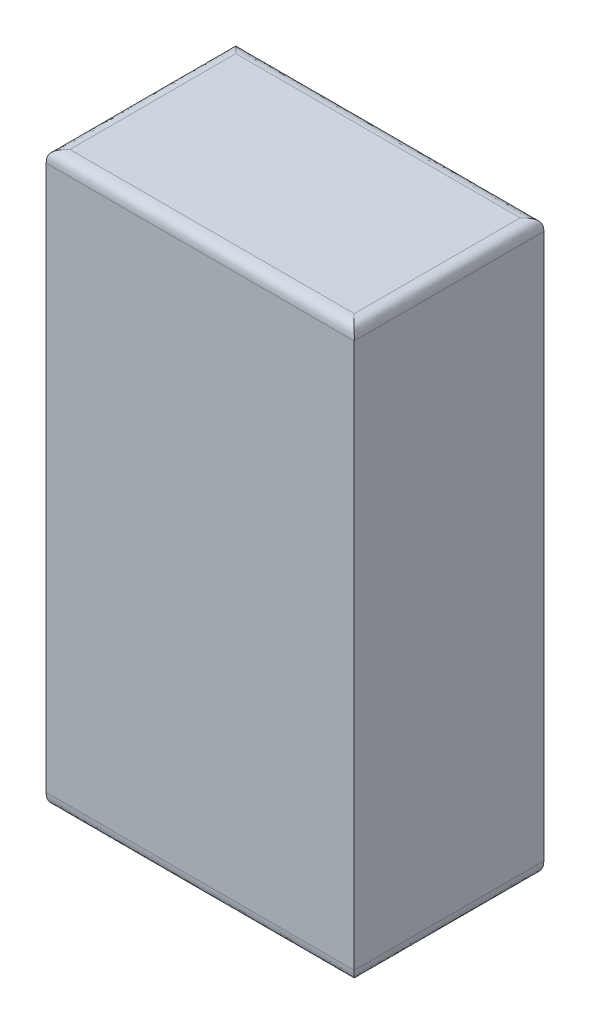
from build123d import *

# Parameters (mm, degrees)
SKETCH1_W           = 26
SKETCH1_H           = 48
BOSS_EXTRUDE1_DEPTH = 16
FILLET1_SIZE        = 1


with BuildPart() as part:
    # Sketch1 → Boss-Extrude1 (new body)
    with BuildSketch(Plane.XY):
        with Locations((-11.532370597, -6.18815331)):
            Rectangle(SKETCH1_W, SKETCH1_H)
    extrude(amount=BOSS_EXTRUDE1_DEPTH)

    # Fillet1
    # a fillet whose section is not a circle: 1 mm, written as the material it takes off along each edge
    with BuildSketch(Plane(origin=(-24.532370597, -30.18815331, -2.5), x_dir=(1, 0, 0), z_dir=(0, 0, 1)), Plane(origin=(1.467629403, -30.18815331, -2.5), x_dir=(0, 1, 0), z_dir=(0, 0, 1)), Plane(origin=(1.467629403, 17.81184669, -2.5), x_dir=(-1, 0, 0), z_dir=(0, 0, 1))) as fillet1_piece_1:
        with BuildLine():
            add(Edge.make_bspline([(FILLET1_SIZE, 0), (FILLET1_SIZE * 0.831801948466, 0), (FILLET1_SIZE * 0.663603896932, 0), (FILLET1_SIZE * 0.292893218813, FILLET1_SIZE * 0.0716919198361), (FILLET1_SIZE * 0.0716919198361, FILLET1_SIZE * 0.292893218813), (0, FILLET1_SIZE * 0.663603896932), (0, FILLET1_SIZE * 0.831801948466), (0, FILLET1_SIZE)], knots=[0, 0, 0, 0, 0, 0, 0.5, 0.5, 1, 1, 1, 1, 1, 1], degree=5))
            Line((0, FILLET1_SIZE), (0, 0))
            Line((0, 0), (FILLET1_SIZE, 0))
        make_face()
    extrude(amount=21, mode=Mode.SUBTRACT)
    with BuildSketch(Plane(origin=(3.967629403, -30.18815331, 0), x_dir=(0, 0, 1), z_dir=(-1, 0, 0)), Plane(origin=(-27.032370597, 17.81184669, 0), x_dir=(0, 0, 1), z_dir=(1, 0, 0))) as fillet1_piece_2:
        with BuildLine():
            add(Edge.make_bspline([(FILLET1_SIZE, 0), (FILLET1_SIZE * 0.831801948466, 0), (FILLET1_SIZE * 0.663603896932, 0), (FILLET1_SIZE * 0.292893218813, FILLET1_SIZE * 0.0716919198361), (FILLET1_SIZE * 0.0716919198361, FILLET1_SIZE * 0.292893218813), (0, FILLET1_SIZE * 0.663603896932), (0, FILLET1_SIZE * 0.831801948466), (0, FILLET1_SIZE)], knots=[0, 0, 0, 0, 0, 0, 0.5, 0.5, 1, 1, 1, 1, 1, 1], degree=5))
            Line((0, FILLET1_SIZE), (0, 0))
            Line((0, 0), (FILLET1_SIZE, 0))
        make_face()
    extrude(amount=31, mode=Mode.SUBTRACT)
    with BuildSketch(Plane(origin=(3.967629403, -30.18815331, 16), x_dir=(0, 0, -1), z_dir=(-1, 0, 0)), Plane(origin=(-27.032370597, 17.81184669, 16), x_dir=(0, 0, -1), z_dir=(1, 0, 0))) as fillet1_piece_3:
        with BuildLine():
            add(Edge.make_bspline([(FILLET1_SIZE, 0), (FILLET1_SIZE * 0.831801948466, 0), (FILLET1_SIZE * 0.663603896932, 0), (FILLET1_SIZE * 0.292893218813, -FILLET1_SIZE * 0.0716919198361), (FILLET1_SIZE * 0.0716919198361, -FILLET1_SIZE * 0.292893218813), (0, -FILLET1_SIZE * 0.663603896932), (0, -FILLET1_SIZE * 0.831801948466), (0, -FILLET1_SIZE)], knots=[0, 0, 0, 0, 0, 0, 0.5, 0.5, 1, 1, 1, 1, 1, 1], degree=5))
            Line((0, -FILLET1_SIZE), (0, 0))
            Line((0, 0), (FILLET1_SIZE, 0))
        make_face()
    extrude(amount=31, mode=Mode.SUBTRACT)
    with BuildSketch(Plane(origin=(-24.532370597, 17.81184669, -2.5), x_dir=(1, 0, 0), z_dir=(0, 0, 1))) as fillet1_piece_4:
        with BuildLine():
            add(Edge.make_bspline([(FILLET1_SIZE, 0), (FILLET1_SIZE * 0.831801948466, 0), (FILLET1_SIZE * 0.663603896932, 0), (FILLET1_SIZE * 0.292893218813, -FILLET1_SIZE * 0.0716919198361), (FILLET1_SIZE * 0.0716919198361, -FILLET1_SIZE * 0.292893218813), (0, -FILLET1_SIZE * 0.663603896932), (0, -FILLET1_SIZE * 0.831801948466), (0, -FILLET1_SIZE)], knots=[0, 0, 0, 0, 0, 0, 0.5, 0.5, 1, 1, 1, 1, 1, 1], degree=5))
            Line((0, -FILLET1_SIZE), (0, 0))
            Line((0, 0), (FILLET1_SIZE, 0))
        make_face()
    extrude(amount=21, mode=Mode.SUBTRACT)


solid = part.part
